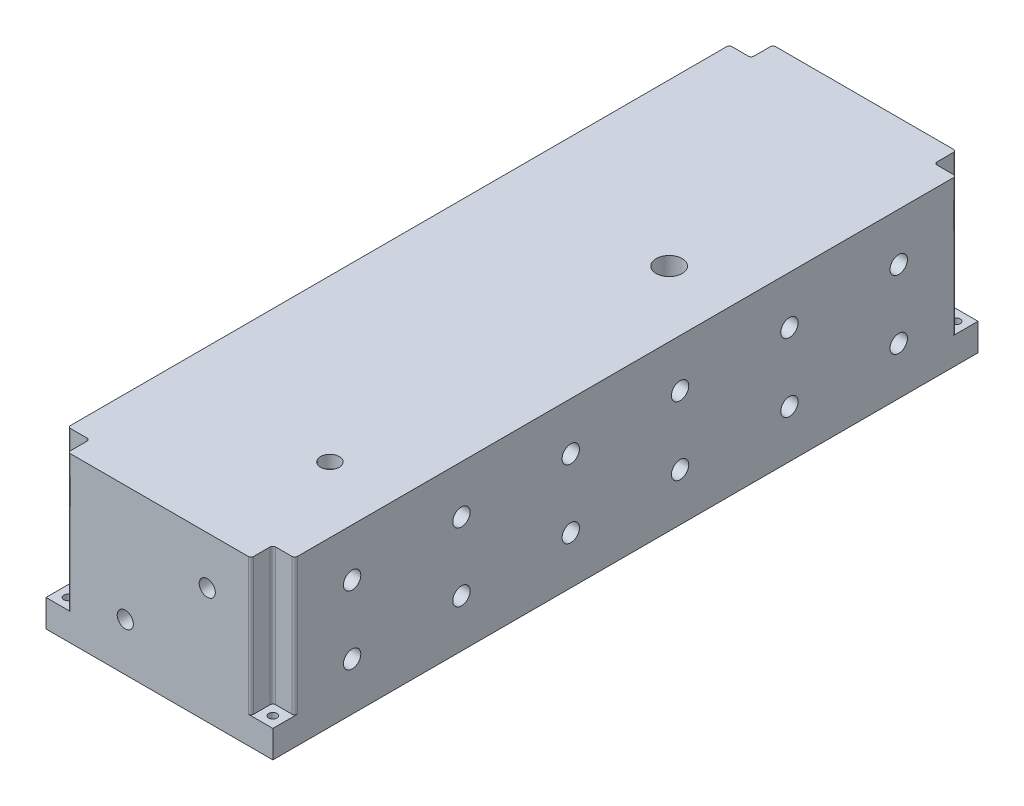
from build123d import *

# Parameters (mm, degrees)
ESBO_O1_W                                  = 166
ESBO_O1_H                                  = 120
RESSALTO_EXTRUS_O2_DEPTH                   = 516
ESBO_O19_R                                 = 9.525
FUROLINHAP_DEPTH                           = 490.6
ESBO_O21_R                                 = 9.525
FUROLINHAT_DEPTH                           = 490.6
LETRAP_DEPTH                               = 0.5
LETRAT_DEPTH                               = 0.5
ESBO_O12_W                                 = 16
ESBO_O12_H                                 = 16
CORTE_EXTRUS_O5_DEPTH                      = 100
FUROS_GUIA_COM_6_0MM1_D                    = 6
ESPELHAR2_COPY_1_D                         = 6
FILETE2_R                                  = 2
FILETE3_R                                  = 2
FILETE4_R                                  = 2
FILETE5_R                                  = 2
FURO_ROSCADO_DE_G1_4_SENSORP_BSP_D         = 11.8
FURO_ROSCADO_DE_G1_4_SENSORT_BSP_D         = 11.8
CORTE_EXTRUS_O_DISTRIBUI_O_P_REACH         = 557.168
CORTE_EXTRUS_O_DISTRIBUI_O_P_END_RADIUS    = 9.525
ESBO_O51_R                                 = 6.35
CORTE_EXTRUS_O_DISTRIBUI_O_T_REACH         = 557.168
CORTE_EXTRUS_O_DISTRIBUI_O_T_END_RADIUS    = 9.525
ESBO_O52_R                                 = 6.35
FURO_ROSCADO_DE_G1_2_ACUMULADOR_BSP_REACH  = 557.168
FURO_ROSCADO_DE_G1_2_ACUMULADOR_BSP_BORE_R = 9.5


# Read off the part's stored shape, not the designer's step: Furo roscado de G1/4 Barometro NPT
with BuildPart() as part:
    # Esboço1 → Ressalto-extrusão2 (new body)
    with BuildSketch(Plane.XY):
        with Locations((83, 60)):
            Rectangle(ESBO_O1_W, ESBO_O1_H)
    extrude(amount=RESSALTO_EXTRUS_O2_DEPTH)

    # Esboço19 → FuroLinhaP (cut)
    with BuildSketch(Plane(origin=(0, 0, 0), x_dir=(-1, 0, 0), z_dir=(0, 0, -1))):
        with Locations((-118, 85)):
            Circle(ESBO_O19_R)
    extrude(amount=-FUROLINHAP_DEPTH, mode=Mode.SUBTRACT)

    # Esboço21 → FuroLinhaT (cut)
    with BuildSketch(Plane(origin=(0, 0, 0), x_dir=(-1, 0, 0), z_dir=(0, 0, -1))):
        with Locations((-58, 35)):
            Circle(ESBO_O21_R)
    extrude(amount=-FUROLINHAT_DEPTH, mode=Mode.SUBTRACT)

    # Esboço3 → LetraP (add)
    with BuildSketch(Plane(origin=(0, 0, 0), x_dir=(-1, 0, 0), z_dir=(0, 0, -1))):
        with BuildLine():
            Line((-90.915031484, 103.216357136), (-90.228633246, 103.216357136))
            add(Edge.make_bspline(
                [(-90.228633246, 103.216357136), (-90.18142234, 103.21630524), (-90.090964148, 103.216205804), (-89.961249092, 103.213191058), (-89.84343936, 103.209164366), (-89.737788979, 103.203582473), (-89.643972881, 103.196985883), (-89.562415582, 103.187733843), (-89.492476025, 103.178073548), (-89.450569576, 103.168252141), (-89.431457766, 103.163773001)],
                knots=[0, 0, 0, 0, 1.415646017, 2.712440637, 3.8905458, 4.950247383, 5.884950622, 6.709939814, 7.411656543, 8, 8, 8, 8], degree=3))
            add(Edge.make_bspline(
                [(-89.431457766, 103.163773001), (-89.407264232, 103.157151051), (-89.359447255, 103.14406319), (-89.290546212, 103.117849466), (-89.224992366, 103.086767301), (-89.162560808, 103.051343361), (-89.104018725, 103.010057797), (-89.048492684, 102.964584179), (-88.996472703, 102.913872611), (-88.948251311, 102.858491871), (-88.903966514, 102.799371661), (-88.865836831, 102.735629431), (-88.833909604, 102.668338128), (-88.806526333, 102.597544557), (-88.786817878, 102.522654233), (-88.771970978, 102.444187521), (-88.762547351, 102.36215283), (-88.761644789, 102.306092963), (-88.76118533, 102.277555053)],
                knots=[0, 0, 0, 0, 0.999701418, 1.975846123, 2.934577507, 3.890451536, 4.834027766, 5.787354733, 6.749476667, 7.726910423, 8.712836071, 9.690891519, 10.682875813, 11.679750201, 12.712814741, 13.765529915, 14.8625177, 16, 16, 16, 16], degree=3))
            add(Edge.make_bspline(
                [(-88.76118533, 102.277555053), (-88.761606755, 102.248777276), (-88.7624313, 102.192471612), (-88.772327586, 102.110098824), (-88.785657777, 102.031380433), (-88.80615483, 101.956490983), (-88.833000503, 101.885875213), (-88.864492556, 101.818453981), (-88.902476086, 101.755374309), (-88.946120916, 101.696407191), (-88.99467251, 101.641497279), (-89.047925448, 101.591042484), (-89.105664741, 101.545338146), (-89.167706889, 101.504281802), (-89.234656738, 101.468825523), (-89.305498891, 101.437068218), (-89.380849108, 101.410397157), (-89.432991622, 101.396367096), (-89.459502637, 101.389233738)],
                knots=[0, 0, 0, 0, 1.121902311, 2.195077645, 3.232258892, 4.234102512, 5.217864754, 6.176164875, 7.132989551, 8.084763148, 9.034132444, 9.988522005, 10.94243251, 11.903244335, 12.886203696, 13.894208494, 14.929344452, 16, 16, 16, 16], degree=3))
            add(Edge.make_bspline(
                [(-89.459502637, 101.389233738), (-89.481429971, 101.384570757), (-89.529484999, 101.374351563), (-89.608627721, 101.362943106), (-89.700773107, 101.353205506), (-89.805795387, 101.345904368), (-89.923600292, 101.339654), (-90.054251549, 101.334685906), (-90.198005626, 101.331956052), (-90.29827687, 101.331815259), (-90.350628439, 101.331741751)],
                knots=[0, 0, 0, 0, 0.601384939, 1.31797006, 2.144135048, 3.087295005, 4.142315834, 5.309527816, 6.595305764, 8, 8, 8, 8], degree=3))
            Line((-90.350628439, 101.331741751), (-90.60092892, 101.331741751))
            Line((-90.60092892, 101.331741751), (-90.60092892, 99.716357136))
            Line((-90.60092892, 99.716357136), (-90.915031484, 99.716357136))
            Line((-90.915031484, 99.716357136), (-90.915031484, 103.216357136))
        make_face()
        with BuildLine():
            Line((-90.60092892, 102.857382777), (-90.60092892, 101.69071611))
            Line((-90.60092892, 101.69071611), (-89.988148471, 101.68300377))
            add(Edge.make_bspline(
                [(-89.988148471, 101.68300377), (-89.958228545, 101.682988307), (-89.900468745, 101.682958455), (-89.817032522, 101.686943678), (-89.739623235, 101.691544211), (-89.668478659, 101.698280134), (-89.603566725, 101.707801392), (-89.544779196, 101.71741313), (-89.492571913, 101.731318492), (-89.431472711, 101.750041561), (-89.363389364, 101.781974177), (-89.289321815, 101.828324067), (-89.226551229, 101.887404775), (-89.172232932, 101.953832607), (-89.129127054, 102.027731736), (-89.097571062, 102.106800673), (-89.079029904, 102.190228522), (-89.076543711, 102.247316661), (-89.075287894, 102.276152809)],
                knots=[0, 0, 0, 0, 1.160613943, 2.240541288, 3.23993089, 4.169200891, 5.011653406, 5.7853311, 6.478053781, 7.106038997, 8.262395093, 9.384106736, 10.481365981, 11.59014053, 12.70357646, 13.786202915, 14.881775077, 16, 16, 16, 16], degree=3))
            add(Edge.make_bspline(
                [(-89.075287894, 102.276152809), (-89.07655054, 102.304291322), (-89.079060525, 102.360227205), (-89.097716389, 102.442205965), (-89.129065702, 102.52044167), (-89.172522297, 102.593414755), (-89.225263427, 102.659603559), (-89.28656277, 102.717100686), (-89.356276031, 102.763322389), (-89.421124262, 102.79315567), (-89.478725448, 102.811370946), (-89.528757408, 102.824115786), (-89.585248083, 102.834291392), (-89.648215862, 102.842530895), (-89.717172696, 102.849584356), (-89.792711011, 102.854370334), (-89.874544654, 102.85717179), (-89.931355225, 102.857310745), (-89.960804721, 102.857382777)],
                knots=[0, 0, 0, 0, 1.120700087, 2.227813068, 3.331159281, 4.466773991, 5.599788987, 6.693661531, 7.80175334, 8.91857717, 9.525282508, 10.207424825, 10.974604443, 11.810962634, 12.737642355, 13.736264703, 14.826523623, 16, 16, 16, 16], degree=3))
            Line((-89.960804721, 102.857382777), (-90.60092892, 102.857382777))
        make_face(mode=Mode.SUBTRACT)
    extrude(amount=LETRAP_DEPTH)

    # Esboço4 → LetraT (cut)
    with BuildSketch(Plane(origin=(0, 0, 0), x_dir=(-1, 0, 0), z_dir=(0, 0, -1))):
        Polygon((-41.133968383, 48.625848745), (-41.133968383, 48.984823104), (-39.294224793, 48.984823104), (-39.294224793, 48.625848745), (-40.057045306, 48.625848745), (-40.057045306, 45.484823104), (-40.37114787, 45.484823104), (-40.37114787, 48.625848745), align=None)
    extrude(amount=-LETRAT_DEPTH, mode=Mode.SUBTRACT)

    # Esboço12 → Corte-extrusão5 (cut)
    with BuildSketch(Plane(origin=(0, 120, 0), x_dir=(1, 0, 0), z_dir=(0, 1, 0))):
        with Locations((158, -8)):
            Rectangle(ESBO_O12_W, ESBO_O12_H)
        with Locations((8, -8)):
            Rectangle(ESBO_O12_W, ESBO_O12_H)
        with Locations((8, -508)):
            Rectangle(ESBO_O12_W, ESBO_O12_H)
        with Locations((158, -508)):
            Rectangle(ESBO_O12_W, ESBO_O12_H)
    extrude(amount=-CORTE_EXTRUS_O5_DEPTH, mode=Mode.SUBTRACT)

    # Furos-guia com Ø6.0mm1 (through all)
    with Locations(Plane(origin=(0, 20, 0), x_dir=(1, 0, 0), z_dir=(0, 1, 0))):
        with Locations((158, -8)):
            furos_guia_com_6_0mm1 = Hole(FUROS_GUIA_COM_6_0MM1_D / 2)

    # Espelhar1: Furos-guia com Ø6.0mm1 across plane
    add(furos_guia_com_6_0mm1.mirror(Plane.XY.offset(258)), mode=Mode.SUBTRACT)

    # Espelhar2: Furos-guia com Ø6.0mm1 across plane
    add(furos_guia_com_6_0mm1.mirror(Plane(origin=(83, 0, 0), x_dir=(0, 0, 1), z_dir=(1, 0, 0))), mode=Mode.SUBTRACT)

    # Espelhar2 copy 1 (through all)
    with Locations(Plane(origin=(166, 20, 516), x_dir=(-1, 0, 0), z_dir=(0, 1, 0))):
        with Locations((158, -8)):
            Hole(ESPELHAR2_COPY_1_D / 2)

    # Filete2
    filete2_edges = [part.edges().sort_by_distance(p)[0] for p in [
        (166, 70, 16),
        (150, 70, 16),
        (150, 70, 0),
    ]]
    fillet(filete2_edges, radius=FILETE2_R)

    # Filete3
    filete3_edges = [part.edges().sort_by_distance(p)[0] for p in [
        (16, 70, 0),
        (16, 70, 16),
        (0, 70, 16),
    ]]
    fillet(filete3_edges, radius=FILETE3_R)

    # Filete4
    filete4_edges = [part.edges().sort_by_distance(p)[0] for p in [
        (150, 70, 516),
        (150, 70, 500),
        (166, 70, 500),
    ]]
    fillet(filete4_edges, radius=FILETE4_R)

    # Filete5
    filete5_edges = [part.edges().sort_by_distance(p)[0] for p in [
        (0, 70, 500),
        (16, 70, 500),
        (16, 70, 516),
    ]]
    fillet(filete5_edges, radius=FILETE5_R)

    # Furo roscado de G1/4 SensorP BSP (through all)
    with Locations(Plane.XY.offset(516)):
        with Locations((118, 85)):
            Hole(FURO_ROSCADO_DE_G1_4_SENSORP_BSP_D / 2)

    # Furo roscado de G1/4 SensorT BSP (through all)
    with Locations(Plane.XY.offset(516)):
        with Locations((58, 35)):
            Hole(FURO_ROSCADO_DE_G1_4_SENSORT_BSP_D / 2)

    # Corte-extrusão Distribuição P: up to this cylinder (the profile starts outside it)
    corte_extrus_o_distribui_o_p_end = Plane(origin=(118, 85, 258), z_dir=(0, 0, -1)) * Cylinder(CORTE_EXTRUS_O_DISTRIBUI_O_P_END_RADIUS, 1534.386, mode=Mode.PRIVATE)
    # Esboço51 → Corte-extrusão Distribuição P (cut, up to the surface)
    with BuildSketch(Plane(origin=(166, 0, 0), x_dir=(0, 0, -1), z_dir=(1, 0, 0)), mode=Mode.PRIVATE) as corte_extrus_o_distribui_o_p_sk1:
        with Locations(Location((-218, 85, 0), (0, 0, 90))):
            Circle(ESBO_O51_R)
    corte_extrus_o_distribui_o_p_tool1 = extrude(corte_extrus_o_distribui_o_p_sk1.sketch, amount=-CORTE_EXTRUS_O_DISTRIBUI_O_P_REACH, mode=Mode.PRIVATE) - corte_extrus_o_distribui_o_p_end
    add(corte_extrus_o_distribui_o_p_tool1.solids().sort_by_distance((166, 85, 218))[0], mode=Mode.SUBTRACT)
    # Esboço51 → Corte-extrusão Distribuição P (cut, up to the surface)
    with BuildSketch(Plane(origin=(166, 0, 0), x_dir=(0, 0, -1), z_dir=(1, 0, 0)), mode=Mode.PRIVATE) as corte_extrus_o_distribui_o_p_sk2:
        with Locations(Location((-138, 85, 0), (0, 0, 90))):
            Circle(ESBO_O51_R)
    corte_extrus_o_distribui_o_p_tool2 = extrude(corte_extrus_o_distribui_o_p_sk2.sketch, amount=-CORTE_EXTRUS_O_DISTRIBUI_O_P_REACH, mode=Mode.PRIVATE) - corte_extrus_o_distribui_o_p_end
    add(corte_extrus_o_distribui_o_p_tool2.solids().sort_by_distance((166, 85, 138))[0], mode=Mode.SUBTRACT)
    # Esboço51 → Corte-extrusão Distribuição P (cut, up to the surface)
    with BuildSketch(Plane(origin=(166, 0, 0), x_dir=(0, 0, -1), z_dir=(1, 0, 0)), mode=Mode.PRIVATE) as corte_extrus_o_distribui_o_p_sk3:
        with Locations(Location((-58, 85, 0), (0, 0, 90))):
            Circle(ESBO_O51_R)
    corte_extrus_o_distribui_o_p_tool3 = extrude(corte_extrus_o_distribui_o_p_sk3.sketch, amount=-CORTE_EXTRUS_O_DISTRIBUI_O_P_REACH, mode=Mode.PRIVATE) - corte_extrus_o_distribui_o_p_end
    add(corte_extrus_o_distribui_o_p_tool3.solids().sort_by_distance((166, 85, 58))[0], mode=Mode.SUBTRACT)
    # Esboço51 → Corte-extrusão Distribuição P (cut, up to the surface)
    with BuildSketch(Plane(origin=(166, 0, 0), x_dir=(0, 0, -1), z_dir=(1, 0, 0)), mode=Mode.PRIVATE) as corte_extrus_o_distribui_o_p_sk4:
        with Locations(Location((-458, 85, 0), (0, 0, 90))):
            Circle(ESBO_O51_R)
    corte_extrus_o_distribui_o_p_tool4 = extrude(corte_extrus_o_distribui_o_p_sk4.sketch, amount=-CORTE_EXTRUS_O_DISTRIBUI_O_P_REACH, mode=Mode.PRIVATE) - corte_extrus_o_distribui_o_p_end
    add(corte_extrus_o_distribui_o_p_tool4.solids().sort_by_distance((166, 85, 458))[0], mode=Mode.SUBTRACT)
    # Esboço51 → Corte-extrusão Distribuição P (cut, up to the surface)
    with BuildSketch(Plane(origin=(166, 0, 0), x_dir=(0, 0, -1), z_dir=(1, 0, 0)), mode=Mode.PRIVATE) as corte_extrus_o_distribui_o_p_sk5:
        with Locations(Location((-378, 85, 0), (0, 0, 90))):
            Circle(ESBO_O51_R)
    corte_extrus_o_distribui_o_p_tool5 = extrude(corte_extrus_o_distribui_o_p_sk5.sketch, amount=-CORTE_EXTRUS_O_DISTRIBUI_O_P_REACH, mode=Mode.PRIVATE) - corte_extrus_o_distribui_o_p_end
    add(corte_extrus_o_distribui_o_p_tool5.solids().sort_by_distance((166, 85, 378))[0], mode=Mode.SUBTRACT)
    # Esboço51 → Corte-extrusão Distribuição P (cut, up to the surface)
    with BuildSketch(Plane(origin=(166, 0, 0), x_dir=(0, 0, -1), z_dir=(1, 0, 0)), mode=Mode.PRIVATE) as corte_extrus_o_distribui_o_p_sk6:
        with Locations(Location((-298, 85, 0), (0, 0, 90))):
            Circle(ESBO_O51_R)
    corte_extrus_o_distribui_o_p_tool6 = extrude(corte_extrus_o_distribui_o_p_sk6.sketch, amount=-CORTE_EXTRUS_O_DISTRIBUI_O_P_REACH, mode=Mode.PRIVATE) - corte_extrus_o_distribui_o_p_end
    add(corte_extrus_o_distribui_o_p_tool6.solids().sort_by_distance((166, 85, 298))[0], mode=Mode.SUBTRACT)

    # Corte-extrusão Distribuição T: up to this cylinder (the profile starts outside it)
    corte_extrus_o_distribui_o_t_end = Plane(origin=(58, 35, 258), z_dir=(0, 0, -1)) * Cylinder(CORTE_EXTRUS_O_DISTRIBUI_O_T_END_RADIUS, 1534.386, mode=Mode.PRIVATE)
    # Esboço52 → Corte-extrusão Distribuição T (cut, up to the surface)
    with BuildSketch(Plane(origin=(166, 0, 0), x_dir=(0, 0, -1), z_dir=(1, 0, 0)), mode=Mode.PRIVATE) as corte_extrus_o_distribui_o_t_sk1:
        with Locations(Location((-218, 35, 0), (0, 0, 90))):
            Circle(ESBO_O52_R)
    corte_extrus_o_distribui_o_t_tool1 = extrude(corte_extrus_o_distribui_o_t_sk1.sketch, amount=-CORTE_EXTRUS_O_DISTRIBUI_O_T_REACH, mode=Mode.PRIVATE) - corte_extrus_o_distribui_o_t_end
    add(corte_extrus_o_distribui_o_t_tool1.solids().sort_by_distance((166, 35, 218))[0], mode=Mode.SUBTRACT)
    # Esboço52 → Corte-extrusão Distribuição T (cut, up to the surface)
    with BuildSketch(Plane(origin=(166, 0, 0), x_dir=(0, 0, -1), z_dir=(1, 0, 0)), mode=Mode.PRIVATE) as corte_extrus_o_distribui_o_t_sk2:
        with Locations(Location((-138, 35, 0), (0, 0, 90))):
            Circle(ESBO_O52_R)
    corte_extrus_o_distribui_o_t_tool2 = extrude(corte_extrus_o_distribui_o_t_sk2.sketch, amount=-CORTE_EXTRUS_O_DISTRIBUI_O_T_REACH, mode=Mode.PRIVATE) - corte_extrus_o_distribui_o_t_end
    add(corte_extrus_o_distribui_o_t_tool2.solids().sort_by_distance((166, 35, 138))[0], mode=Mode.SUBTRACT)
    # Esboço52 → Corte-extrusão Distribuição T (cut, up to the surface)
    with BuildSketch(Plane(origin=(166, 0, 0), x_dir=(0, 0, -1), z_dir=(1, 0, 0)), mode=Mode.PRIVATE) as corte_extrus_o_distribui_o_t_sk3:
        with Locations(Location((-58, 35, 0), (0, 0, 90))):
            Circle(ESBO_O52_R)
    corte_extrus_o_distribui_o_t_tool3 = extrude(corte_extrus_o_distribui_o_t_sk3.sketch, amount=-CORTE_EXTRUS_O_DISTRIBUI_O_T_REACH, mode=Mode.PRIVATE) - corte_extrus_o_distribui_o_t_end
    add(corte_extrus_o_distribui_o_t_tool3.solids().sort_by_distance((166, 35, 58))[0], mode=Mode.SUBTRACT)
    # Esboço52 → Corte-extrusão Distribuição T (cut, up to the surface)
    with BuildSketch(Plane(origin=(166, 0, 0), x_dir=(0, 0, -1), z_dir=(1, 0, 0)), mode=Mode.PRIVATE) as corte_extrus_o_distribui_o_t_sk4:
        with Locations(Location((-458, 35, 0), (0, 0, 90))):
            Circle(ESBO_O52_R)
    corte_extrus_o_distribui_o_t_tool4 = extrude(corte_extrus_o_distribui_o_t_sk4.sketch, amount=-CORTE_EXTRUS_O_DISTRIBUI_O_T_REACH, mode=Mode.PRIVATE) - corte_extrus_o_distribui_o_t_end
    add(corte_extrus_o_distribui_o_t_tool4.solids().sort_by_distance((166, 35, 458))[0], mode=Mode.SUBTRACT)
    # Esboço52 → Corte-extrusão Distribuição T (cut, up to the surface)
    with BuildSketch(Plane(origin=(166, 0, 0), x_dir=(0, 0, -1), z_dir=(1, 0, 0)), mode=Mode.PRIVATE) as corte_extrus_o_distribui_o_t_sk5:
        with Locations(Location((-378, 35, 0), (0, 0, 90))):
            Circle(ESBO_O52_R)
    corte_extrus_o_distribui_o_t_tool5 = extrude(corte_extrus_o_distribui_o_t_sk5.sketch, amount=-CORTE_EXTRUS_O_DISTRIBUI_O_T_REACH, mode=Mode.PRIVATE) - corte_extrus_o_distribui_o_t_end
    add(corte_extrus_o_distribui_o_t_tool5.solids().sort_by_distance((166, 35, 378))[0], mode=Mode.SUBTRACT)
    # Esboço52 → Corte-extrusão Distribuição T (cut, up to the surface)
    with BuildSketch(Plane(origin=(166, 0, 0), x_dir=(0, 0, -1), z_dir=(1, 0, 0)), mode=Mode.PRIVATE) as corte_extrus_o_distribui_o_t_sk6:
        with Locations(Location((-298, 35, 0), (0, 0, 90))):
            Circle(ESBO_O52_R)
    corte_extrus_o_distribui_o_t_tool6 = extrude(corte_extrus_o_distribui_o_t_sk6.sketch, amount=-CORTE_EXTRUS_O_DISTRIBUI_O_T_REACH, mode=Mode.PRIVATE) - corte_extrus_o_distribui_o_t_end
    add(corte_extrus_o_distribui_o_t_tool6.solids().sort_by_distance((166, 35, 298))[0], mode=Mode.SUBTRACT)

    # Furo roscado de G1/4 Barometro NPT outli → Furo roscado de G1/4 Barometro NPT (revolve, cut)
    with BuildSketch(Plane(origin=(118, 0, 426.25), x_dir=(1, 0, 0), z_dir=(0, 0, 1))):
        Polygon((0, 92.731863505), (5.5626, 92.731863505), (5.5626, 111), (6.557984447, 111), (6.8274565, 120), (0, 120), align=None)
    revolve(axis=Axis((118, 0, 426.25), (0, 1, 0)), mode=Mode.SUBTRACT)

    # Furo roscado de G1/2 Acumulador BSP bore → Furo roscado de G1/2 Acumulador BSP (cut, up to next)
    with BuildSketch(Plane(origin=(0, 120, 0), x_dir=(1, 0, 0), z_dir=(0, 1, 0)), mode=Mode.PRIVATE) as furo_roscado_de_g1_2_acumulador_bsp_sk1:
        with Locations((118, -178)):
            Circle(FURO_ROSCADO_DE_G1_2_ACUMULADOR_BSP_BORE_R)
    furo_roscado_de_g1_2_acumulador_bsp_tool1 = extrude(furo_roscado_de_g1_2_acumulador_bsp_sk1.sketch, amount=-FURO_ROSCADO_DE_G1_2_ACUMULADOR_BSP_REACH, mode=Mode.PRIVATE) & part.part
    add(furo_roscado_de_g1_2_acumulador_bsp_tool1.solids().sort_by_distance((118, 120, 178))[0], mode=Mode.SUBTRACT)


solid = part.part
